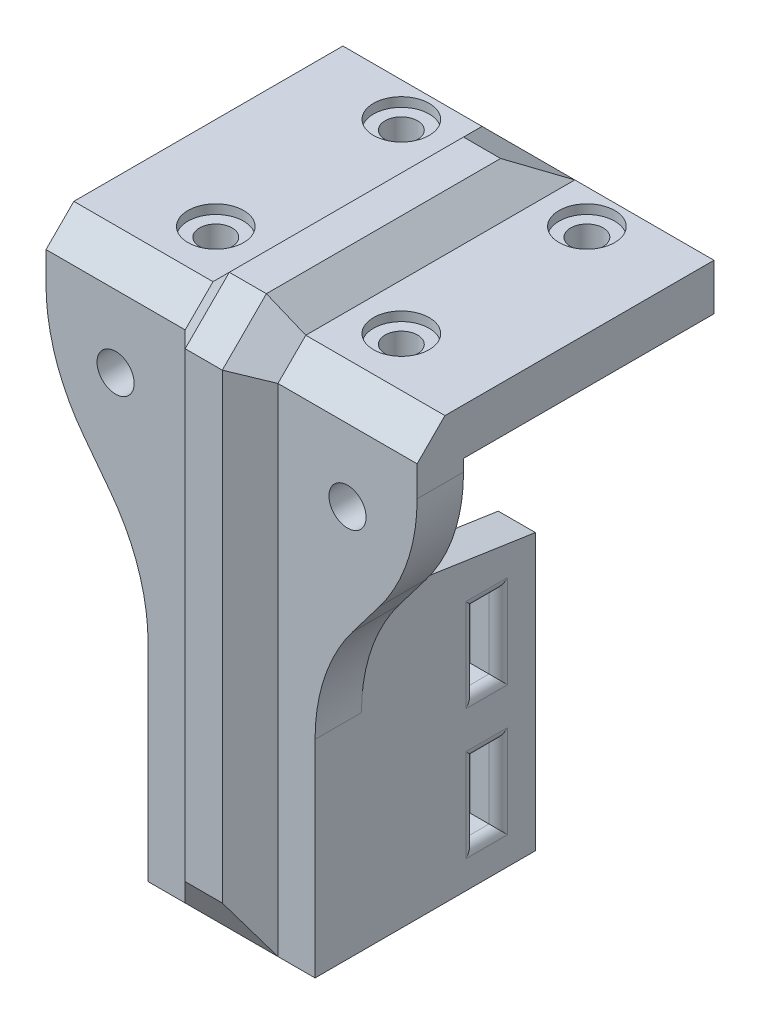
from build123d import *

# Parameters (mm, degrees)
BOSS_EXTRUDE1_DEPTH      = 40
SKETCH2_W                = 40
SKETCH2_H                = 29
BOSS_EXTRUDE2_DEPTH      = 23.5
SKETCH3_W                = 2.5
SKETCH3_H                = 8
CUT_EXTRUDE1_DEPTH       = 77.264342913
CUT_EXTRUDE2_REACH       = 76.863
SKETCH4_W                = 10
SKETCH4_H                = 29
CUT_EXTRUDE3_DEPTH       = 75.863208587
FILLET1_R                = 20
SKETCH6_R                = 2
CUT_EXTRUDE4_DEPTH       = 15.25
CUT_EXTRUDE5_REACH       = 78.264
SKETCH7_R                = 1.75
SKETCH8_R                = 3
CUT_EXTRUDE6_DEPTH       = 1
BOSS_EXTRUDE4_DEPTH      = 2
BOSS_EXTRUDE4_DEPTH_BACK = 2
CHAMFER1_SIZE            = 3
CHAMFER1_SIZE2           = 5
CHAMFER2_SIZE            = 5
CHAMFER2_SIZE2           = 3
CHAMFER3_SIZE            = 3
CHAMFER4_SIZE            = 3
CUT_EXTRUDE7_REACH       = 70.558
BOSS_EXTRUDE5_REACH      = 73.114
SKETCH12_W               = 10
SKETCH12_H               = 11.25
CUT_EXTRUDE8_DEPTH       = 2
FILLET2_R                = 1
SKETCH13_W               = 4.75
SKETCH13_H               = 32.080750089
CUT_EXTRUDE9_DEPTH       = 72.114344545
CUT_EXTRUDE10_REACH      = 76.305
SKETCH14_R               = 2


with BuildPart() as part:
    # Sketch1 → Boss-Extrude1 (new body)
    with BuildSketch(Plane(origin=(0, 0, 0), x_dir=(0, 0, -1), z_dir=(1, 0, 0))):
        Polygon((0, 0), (0, -56.5), (5, -56.5), (5, -5), (32, -5), (32, 0), align=None)
    extrude(amount=BOSS_EXTRUDE1_DEPTH)

    # Sketch2 → Boss-Extrude2 (add)
    with BuildSketch(Plane(origin=(0, 0, -5), x_dir=(-1, 0, 0), z_dir=(0, 0, -1))):
        with Locations((-20, -42)):
            Rectangle(SKETCH2_W, SKETCH2_H)
    extrude(amount=BOSS_EXTRUDE2_DEPTH)

    # Sketch3 → Cut-Extrude1 (cut, through all)
    with BuildSketch(Plane(origin=(40, 0, 0), x_dir=(0, 0, -1), z_dir=(1, 0, 0))):
        with Locations((18.5, -34.5)):
            Rectangle(SKETCH3_W, SKETCH3_H)
        with Locations((18.5, -48.5)):
            Rectangle(SKETCH3_W, SKETCH3_H)
    extrude(amount=-CUT_EXTRUDE1_DEPTH, mode=Mode.SUBTRACT)

    # Cut-Extrude2: up to this face of the body (flat: up to its plane)
    cut_extrude2_end = Plane(part.part.faces().sort_by_distance((20, -34.5, -17.25))[0])
    # Sketch4 → Cut-Extrude2 (cut, up to the picked face)
    with BuildSketch(Plane(origin=(0, 0, -28.5), x_dir=(-1, 0, 0), z_dir=(0, 0, -1)), mode=Mode.PRIVATE) as cut_extrude2_sk1:
        with Locations((-20, -42)):
            Rectangle(SKETCH4_W, SKETCH4_H)
    cut_extrude2_tool1 = split(extrude(cut_extrude2_sk1.sketch, amount=-CUT_EXTRUDE2_REACH, mode=Mode.PRIVATE), bisect_by=cut_extrude2_end, keep=Keep.BOTH, mode=Mode.PRIVATE)
    add(cut_extrude2_tool1.solids().sort_by(Axis((20, -42, -28.5), (0, 0, 1)))[0], mode=Mode.SUBTRACT)

    # Sketch5 → Cut-Extrude3 (cut, through all)
    with BuildSketch(Plane(origin=(0, 0, -28.5), x_dir=(-1, 0, 0), z_dir=(0, 0, -1))):
        Polygon((-29, -27.5), (-29, -56.5), (-40, -56.5), (-40, -13), align=None)
        Polygon((0, -56.5), (0, -13), (-11, -27.5), (-11, -56.5), align=None)
    extrude(amount=-CUT_EXTRUDE3_DEPTH, mode=Mode.SUBTRACT)

    # Fillet1
    fillet1_edges = [part.edges().sort_by_distance(p)[0] for p in [
        (40, -13, -2.5),
        (29, -27.5, -2.5),
        (11, -27.5, -2.5),
        (0, -13, -2.5),
    ]]
    fillet(fillet1_edges, radius=FILLET1_R)

    # Sketch6 → Cut-Extrude4 (cut)
    with BuildSketch(Plane(origin=(0, 0, -17.25), x_dir=(-1, 0, 0), z_dir=(0, 0, -1))):
        with Locations((-20, -42)):
            Circle(SKETCH6_R)
    extrude(amount=-CUT_EXTRUDE4_DEPTH, mode=Mode.SUBTRACT)

    # Sketch7 → Cut-Extrude5 (cut, up to next)
    with BuildSketch(Plane(origin=(0, 0, 0), x_dir=(1, 0, 0), z_dir=(0, 1, 0)), mode=Mode.PRIVATE) as cut_extrude5_sk1:
        with Locations(Location((30, 28.3, 0), (0, 0, 270))):
            Circle(SKETCH7_R)
    cut_extrude5_tool1 = extrude(cut_extrude5_sk1.sketch, amount=-CUT_EXTRUDE5_REACH, mode=Mode.PRIVATE) & part.part
    # Sketch7 → Cut-Extrude5 (cut, up to next)
    with BuildSketch(Plane(origin=(0, 0, 0), x_dir=(1, 0, 0), z_dir=(0, 1, 0)), mode=Mode.PRIVATE) as cut_extrude5_sk2:
        with Locations(Location((30, 8.3, 0), (0, 0, 270))):
            Circle(SKETCH7_R)
    cut_extrude5_tool2 = extrude(cut_extrude5_sk2.sketch, amount=-CUT_EXTRUDE5_REACH, mode=Mode.PRIVATE) & part.part
    # Sketch7 → Cut-Extrude5 (cut, up to next)
    with BuildSketch(Plane(origin=(0, 0, 0), x_dir=(1, 0, 0), z_dir=(0, 1, 0)), mode=Mode.PRIVATE) as cut_extrude5_sk3:
        with Locations(Location((10, 8.3, 0), (0, 0, 270))):
            Circle(SKETCH7_R)
    cut_extrude5_tool3 = extrude(cut_extrude5_sk3.sketch, amount=-CUT_EXTRUDE5_REACH, mode=Mode.PRIVATE) & part.part
    # Sketch7 → Cut-Extrude5 (cut, up to next)
    with BuildSketch(Plane(origin=(0, 0, 0), x_dir=(1, 0, 0), z_dir=(0, 1, 0)), mode=Mode.PRIVATE) as cut_extrude5_sk4:
        with Locations(Location((10, 28.3, 0), (0, 0, 270))):
            Circle(SKETCH7_R)
    cut_extrude5_tool4 = extrude(cut_extrude5_sk4.sketch, amount=-CUT_EXTRUDE5_REACH, mode=Mode.PRIVATE) & part.part
    add(cut_extrude5_tool1.solids().sort_by_distance((30, 0, -28.3))[0], mode=Mode.SUBTRACT)
    add(cut_extrude5_tool2.solids().sort_by_distance((30, 0, -8.3))[0], mode=Mode.SUBTRACT)
    add(cut_extrude5_tool3.solids().sort_by_distance((10, 0, -8.3))[0], mode=Mode.SUBTRACT)
    add(cut_extrude5_tool4.solids().sort_by_distance((10, 0, -28.3))[0], mode=Mode.SUBTRACT)

    # Sketch8 → Cut-Extrude6 (cut)
    with BuildSketch(Plane(origin=(0, 0, 0), x_dir=(1, 0, 0), z_dir=(0, 1, 0))):
        with Locations(Location((30, 28.3, 0), (0, 0, 270))):
            Circle(SKETCH8_R)
        with Locations(Location((30, 8.3, 0), (0, 0, 270))):
            Circle(SKETCH8_R)
        with Locations(Location((10, 8.3, 0), (0, 0, 270))):
            Circle(SKETCH8_R)
        with Locations(Location((10, 28.3, 0), (0, 0, 270))):
            Circle(SKETCH8_R)
    extrude(amount=-CUT_EXTRUDE6_DEPTH, mode=Mode.SUBTRACT)

    # Sketch9 → Boss-Extrude4 (add, two sides: drawn at the far end of the back side and taken through both)
    with BuildSketch(Plane.ZY.offset(-20).offset(-BOSS_EXTRUDE4_DEPTH_BACK)):
        Polygon((-32, 0), (0, 0), (0, -56.5), (3, -56.5), (3, 3), (-32, 3), align=None)
    extrude(amount=BOSS_EXTRUDE4_DEPTH + BOSS_EXTRUDE4_DEPTH_BACK)

    # Chamfer1
    chamfer1_edges = [part.edges().sort_by_distance(p)[0] for p in [
        (20, 3, -32),
    ]]
    chamfer1_side = [part.faces().sort_by_distance(p)[0] for p in [
        (20, -2.273584906, -32),
    ]]
    chamfer(chamfer1_edges, length=CHAMFER1_SIZE, length2=CHAMFER1_SIZE2, reference=chamfer1_side[0])

    # Chamfer2
    chamfer2_edges = [part.edges().sort_by_distance(p)[0] for p in [
        (20, -56.5, 3),
    ]]
    chamfer2_side = [part.faces().sort_by_distance(p)[0] for p in [
        (20, -26.75, 3),
    ]]
    chamfer(chamfer2_edges, length=CHAMFER2_SIZE, length2=CHAMFER2_SIZE2, reference=chamfer2_side[0])

    # Chamfer3
    chamfer3_edges = [part.edges().sort_by_distance(p)[0] for p in [
        (31, 0, 0),
        (9, 0, 0),
        (20, 3, 3),
    ]]
    chamfer(chamfer3_edges, length=CHAMFER3_SIZE)

    # Chamfer4
    chamfer4_edges = [part.edges().sort_by_distance(p)[0] for p in [
        (18, -29.75, 0),
        (18, -1.5, -1.5),
        (18, 0, -17.5),
        (22, -29.75, 0),
        (22, -1.5, -1.5),
        (22, 0, -17.5),
    ]]
    chamfer(chamfer4_edges, length=CHAMFER4_SIZE - 0.0001)  # a hair under: the kernel refuses the full size

    # Cut-Extrude7: up to this plane
    cut_extrude7_end = Plane(origin=(22, 0.621320344, 0.621320344), z_dir=(0.7071067811865434, 0.500000000000003, 0.500000000000003))
    # Sketch10 → Cut-Extrude7 (cut, up to the surface)
    with BuildSketch(Plane.ZY.offset(-18), mode=Mode.PRIVATE) as cut_extrude7_sk1:
        Polygon((-1.757359313, 3), (3, -1.757359313), (3, 0), (0, 3), align=None)
    cut_extrude7_tool1 = split(extrude(cut_extrude7_sk1.sketch, amount=-CUT_EXTRUDE7_REACH, mode=Mode.PRIVATE), bisect_by=cut_extrude7_end, keep=Keep.BOTH, mode=Mode.PRIVATE)
    add(cut_extrude7_tool1.solids().sort_by_distance((18, 1.027484, 1.027484))[0], mode=Mode.SUBTRACT)


with BuildPart() as cut_extrude7_kept_piece:
    # of the separate pieces the step leaves, the one the design keeps (cut_extrude7_pieces_kept)
    add(part.part.solids().sort_by_distance((18, -1.757400734, 2.9999))[0])

    # Boss-Extrude5: up to this face of the body (flat: up to its plane)
    boss_extrude5_end = Plane(cut_extrude7_kept_piece.part.faces().sort_by_distance((29, -42.52414206, -14.549200751))[0])
    # Sketch11 → Boss-Extrude5 (add, up to the picked face)
    with BuildSketch(Plane.ZY.offset(-11), mode=Mode.PRIVATE) as boss_extrude5_sk1:
        Polygon((-28.5, -27.5), (-9.859490986, -24.723753977), (-5, -16.5), (-5, -27.5), align=None)
    boss_extrude5_tool1 = split(extrude(boss_extrude5_sk1.sketch, amount=-BOSS_EXTRUDE5_REACH, mode=Mode.PRIVATE), bisect_by=boss_extrude5_end, keep=Keep.BOTH, mode=Mode.PRIVATE)
    add(boss_extrude5_tool1.solids().sort_by(Axis((11, -24.923314, -10.92545), (1, 0, 0)))[0])

    # Sketch12 → Cut-Extrude8 (cut)
    with BuildSketch(Plane.XZ.offset(27.5)):
        with Locations((20, -22.875)):
            Rectangle(SKETCH12_W, SKETCH12_H)
    extrude(amount=-CUT_EXTRUDE8_DEPTH, mode=Mode.SUBTRACT)

    # Fillet2
    fillet2_edges = [cut_extrude7_kept_piece.edges().sort_by_distance(p)[0] for p in [
        (29, -30.5, -18.5),
        (11, -34.5, -17.25),
        (11, -48.5, -17.25),
        (29, -38.5, -18.5),
        (29, -34.5, -19.75),
        (29, -34.5, -17.25),
        (29, -52.5, -18.5),
        (29, -48.5, -19.75),
        (29, -44.5, -18.5),
        (29, -48.5, -17.25),
        (11, -30.5, -18.5),
        (11, -34.5, -19.75),
        (11, -38.5, -18.5),
        (11, -44.5, -18.5),
        (11, -48.5, -19.75),
        (11, -52.5, -18.5),
        (25, -30.5, -18.5),
        (15, -30.5, -18.5),
        (15, -52.5, -18.5),
        (15, -48.5, -19.75),
        (15, -44.5, -18.5),
        (15, -38.5, -18.5),
        (15, -34.5, -19.75),
        (25, -48.5, -19.75),
        (25, -52.5, -18.5),
        (25, -34.5, -19.75),
        (25, -38.5, -18.5),
        (25, -44.5, -18.5),
    ]]
    fillet(fillet2_edges, radius=FILLET2_R)

    # Sketch13 → Cut-Extrude9 (cut, through all)
    with BuildSketch(Plane(origin=(29, 0, 0), x_dir=(0, 0, -1), z_dir=(1, 0, 0))):
        with Locations((26.125, -40.459624956)):
            Rectangle(SKETCH13_W, SKETCH13_H)
    extrude(amount=-CUT_EXTRUDE9_DEPTH, mode=Mode.SUBTRACT)

    # Sketch14 → Cut-Extrude10 (cut, up to next)
    with BuildSketch(Plane(origin=(0, 0, -5), x_dir=(-1, 0, 0), z_dir=(0, 0, -1)), mode=Mode.PRIVATE) as cut_extrude10_sk1:
        with Locations(Location((-32.5, -10.75, 0), (0, 0, 90))):
            Circle(SKETCH14_R)
    cut_extrude10_tool1 = extrude(cut_extrude10_sk1.sketch, amount=-CUT_EXTRUDE10_REACH, mode=Mode.PRIVATE) & cut_extrude7_kept_piece.part
    # Sketch14 → Cut-Extrude10 (cut, up to next)
    with BuildSketch(Plane(origin=(0, 0, -5), x_dir=(-1, 0, 0), z_dir=(0, 0, -1)), mode=Mode.PRIVATE) as cut_extrude10_sk2:
        with Locations(Location((-7.5, -10.75, 0), (0, 0, 90))):
            Circle(SKETCH14_R)
    cut_extrude10_tool2 = extrude(cut_extrude10_sk2.sketch, amount=-CUT_EXTRUDE10_REACH, mode=Mode.PRIVATE) & cut_extrude7_kept_piece.part
    add(cut_extrude10_tool1.solids().sort_by_distance((32.5, -10.75, -5))[0], mode=Mode.SUBTRACT)
    add(cut_extrude10_tool2.solids().sort_by_distance((7.5, -10.75, -5))[0], mode=Mode.SUBTRACT)


solid = cut_extrude7_kept_piece.part
